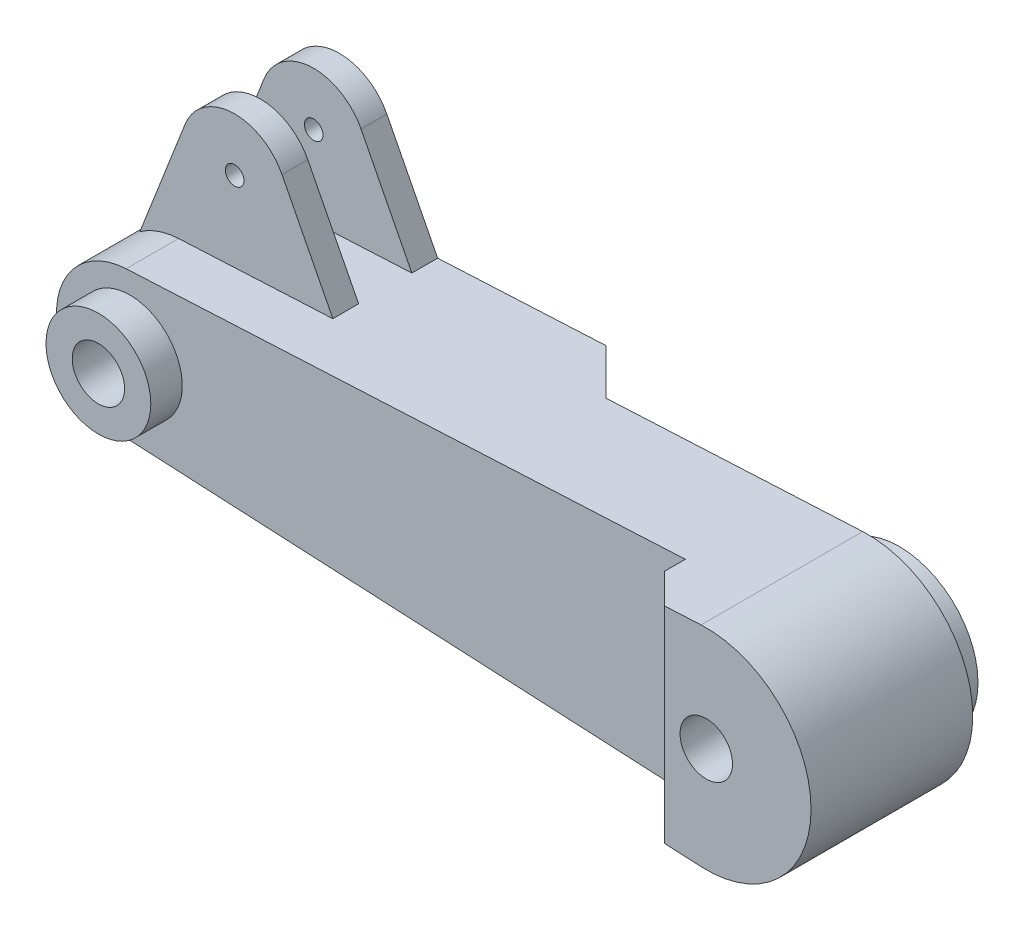
from build123d import *

# Parameters (mm, degrees)
BOSS_EXTRUDE1_DEPTH     = 20
SKETCH2_R               = 2.5
CUT_EXTRUDE1_DEPTH      = 71.632853546
BOSS_EXTRUDE4_DEPTH     = 10
CUT_EXTRUDE2_DEPTH      = 80.703956491
CUT_EXTRUDE2_DEPTH_BACK = 80.703956491
SKETCH6_W               = 5.08
SKETCH6_H               = 17.7
SKETCH7_R               = 0.889
CUT_EXTRUDE3_DEPTH      = 73.716888558
CUT_EXTRUDE4_DEPTH      = 73.716888558
CUT_EXTRUDE4_DEPTH_BACK = 73.716888558
SKETCH8_W               = 40
SKETCH8_H               = 4.572
SKETCH8_W_2             = 60
SKETCH8_H_2             = 5
SKETCH4_R               = 7.5
SKETCH4_R_2             = 2.5
BOSS_EXTRUDE3_DEPTH     = 3
CHAMFER1_SIZE           = 5
BOSS_EXTRUDE2_START     = 3
SKETCH3_R               = 5
SKETCH3_R_2             = 2.5
BOSS_EXTRUDE2_DEPTH     = 3
CHAMFER2_SIZE           = 3


with BuildPart() as part:
    # Sketch1 → Boss-Extrude1 (new body)
    with BuildSketch(Plane.XY):
        with BuildLine():
            Line((-60.35, 6.991244524), (-0.5, 9.987492178))
            ThreePointArc((-0.5, 9.987492178), (10, 0), (-0.5, -9.987492178))
            Line((-0.5, -9.987492178), (-60.35, -6.991244524))
            ThreePointArc((-60.35, -6.991244524), (-67, 0), (-60.35, 6.991244524))
        make_face()
    extrude(amount=BOSS_EXTRUDE1_DEPTH)

    # Sketch2 → Cut-Extrude1 (cut, through all)
    with BuildSketch(Plane.XY.offset(20)):
        with Locations((-60, 0)):
            Circle(SKETCH2_R)
        Circle(SKETCH2_R)
    extrude(amount=-CUT_EXTRUDE1_DEPTH, mode=Mode.SUBTRACT)

    # Sketch5 → Boss-Extrude4 (add)
    with BuildSketch(Plane.XY):
        with BuildLine():
            Line((-60.35, 6.991244524), (-45.63025704, 7.728153385))
            Line((-45.63025704, 7.728153385), (-50.477534128, 17.202429338))
            ThreePointArc((-50.477534128, 17.202429338), (-55.254, 19.962268451), (-59.730944827, 16.739179378))
            Line((-59.730944827, 16.739179378), (-63.60774296, 6.828153385))
            Line((-63.60774296, 6.828153385), (-64.043561758, 5.713983576))
            ThreePointArc((-64.043561758, 5.713983576), (-62.287727062, 6.615610697), (-60.35, 6.991244524))
        make_face()
    extrude(amount=BOSS_EXTRUDE4_DEPTH)

    # Sketch6 → Cut-Extrude2 (cut, two sides: drawn at the far end of the back side and taken through both)
    with BuildSketch(Plane(origin=(-63.598111022, -3.183887901, 0), x_dir=(0, 0, -1), z_dir=(0.9987492177719091, 0.05000000000000006, -2.8501484999108014e-15)).offset(-CUT_EXTRUDE2_DEPTH_BACK)):
        with Locations((-5, 18.85)):
            Rectangle(SKETCH6_W, SKETCH6_H)
    extrude(amount=CUT_EXTRUDE2_DEPTH + CUT_EXTRUDE2_DEPTH_BACK, mode=Mode.SUBTRACT)

    # Sketch7 → Cut-Extrude3 (cut, through all)
    with BuildSketch(Plane.XY.offset(20)):
        with Locations((-55, 14.888622424)):
            Circle(SKETCH7_R)
    extrude(amount=-CUT_EXTRUDE3_DEPTH, mode=Mode.SUBTRACT)

    # Sketch8 → Cut-Extrude4 (cut, two sides: drawn at the far end of the back side and taken through both)
    with BuildSketch(Plane(origin=(0, 0, 0), x_dir=(1, 0, 0), z_dir=(0, 1, 0)).offset(-CUT_EXTRUDE4_DEPTH_BACK)):
        with Locations((-10, -2.286)):
            Rectangle(SKETCH8_W, SKETCH8_H)
        with Locations((-37, -17.5)):
            Rectangle(SKETCH8_W_2, SKETCH8_H_2)
    extrude(amount=CUT_EXTRUDE4_DEPTH + CUT_EXTRUDE4_DEPTH_BACK, mode=Mode.SUBTRACT)

    # Sketch4 → Boss-Extrude3 (add)
    with BuildSketch(Plane(origin=(0, 0, 4.572), x_dir=(-1, 0, 0), z_dir=(0, 0, -1))):
        with Locations(Location((0, 0, 0), (0, 0, 180))):
            Circle(SKETCH4_R)
        with Locations(Location((0, 0, 0), (0, 0, 180))):
            Circle(SKETCH4_R_2, mode=Mode.SUBTRACT)
    extrude(amount=BOSS_EXTRUDE3_DEPTH)

    # Chamfer1
    # the kernel refuses this chamfer: 5 mm, written as the material it adds along each edge
    with BuildSketch(Plane(origin=(-30, -21.369059903, 4.572), x_dir=(-0.027495876610586317, 0, -0.9996219169112968), z_dir=(0, 1, 0))) as chamfer1_piece_1_section:
        Polygon((CHAMFER1_SIZE * 0.999621916911, -CHAMFER1_SIZE * 0.0274958766106), (-CHAMFER1_SIZE * 0.0274958766106, -CHAMFER1_SIZE * 0.999621916911), (0, 0), align=None)
    chamfer1_piece_1 = extrude(amount=42.738119807, mode=Mode.PRIVATE)
    chamfer1_piece_1 = split(chamfer1_piece_1, bisect_by=Plane(origin=(-28.745975843, 8.573424695, 2.975382292), z_dir=(0.050000000000000065, -0.998749217771909, 0)), keep=Keep.TOP, mode=Mode.PRIVATE)
    chamfer1_piece_1 = split(chamfer1_piece_1, bisect_by=Plane(origin=(-28.316767762, 0, 0), z_dir=(0, 0, 1)), keep=Keep.TOP, mode=Mode.PRIVATE)
    chamfer1_piece_1 = split(chamfer1_piece_1, bisect_by=Plane(origin=(-28.745975843, -8.573424695, 2.975382292), z_dir=(0.05000000000000006, 0.998749217771909, 0)), keep=Keep.TOP, mode=Mode.PRIVATE)
    add(chamfer1_piece_1)

    # Sketch3 → Boss-Extrude2 (add)
    with BuildSketch(Plane.XY.offset(15).offset(BOSS_EXTRUDE2_START)):
        with Locations(Location((-60, 0, 0), (0, 0, 180))):
            Circle(SKETCH3_R)
        with Locations((-60, 0)):
            Circle(SKETCH3_R_2, mode=Mode.SUBTRACT)
    extrude(amount=-BOSS_EXTRUDE2_DEPTH)

    # Chamfer2
    chamfer2_edges = [part.edges().sort_by_distance(p)[0] for p in [
        (-7, 0, 20),
    ]]
    chamfer(chamfer2_edges, length=CHAMFER2_SIZE)


solid = part.part
